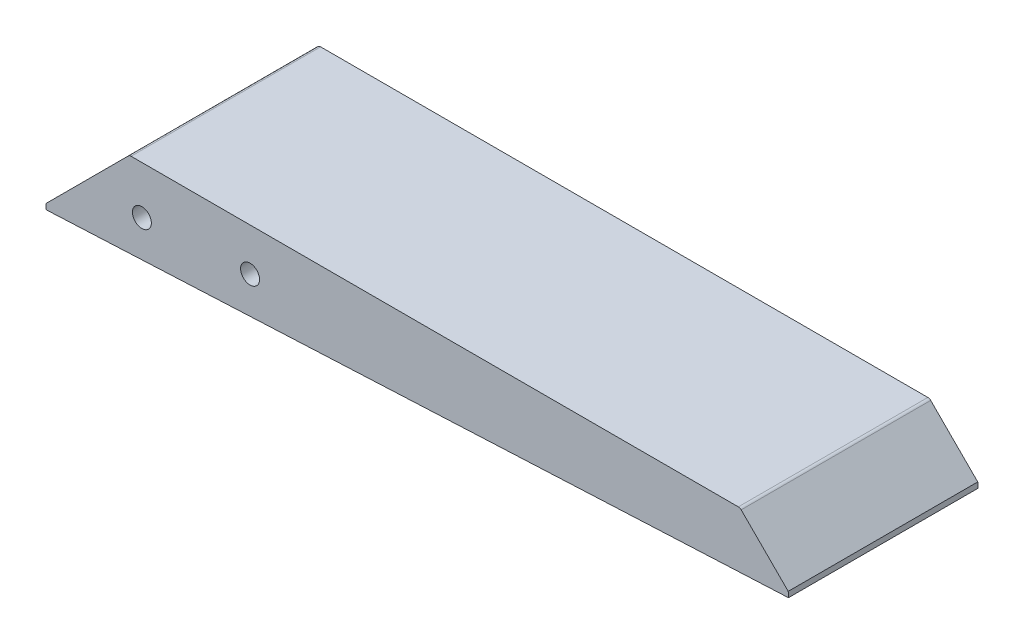
from build123d import *

# Parameters (mm, degrees)
EXTRUDE_1_DEPTH     = 35
SKETCH_2_W          = 137.22254317
SKETCH_2_H          = 35
SKETCH_2_W_2        = 134.22254317
SKETCH_2_H_2        = 32
EXTRUDE_2_DEPTH     = 1
FILLET_1_R          = 2
SKETCH_3_R          = 1.75
CUT_EXTRUDE_1_DEPTH = 6.2
CUT_EXTRUDE_START   = -6.55
SKETCH_4_R          = 1.75
CUT_EXTRUDE_2_DEPTH = 6.55
EXTRUDE_3_DEPTH     = 1


with BuildPart() as part:
    # 草图1 → 凸台-拉伸1 (new body)
    with BuildSketch(Plane.XY):
        with BuildLine():
            Line((29.763864432, 1.094424801), (166.832374142, 7.594424801))
            Line((166.832374142, 7.594424801), (158.142544089, 16.284254855))
            ThreePointArc((158.142544089, 16.284254855), (157.90357385, 16.443929664), (157.621689234, 16.5))
            Line((157.621689234, 16.5), (45.474549341, 16.5))
            ThreePointArc((45.474549341, 16.5), (45.192664725, 16.443929664), (44.953694486, 16.284254855))
            Line((44.953694486, 16.284254855), (29.763864432, 1.094424801))
        make_face()
    extrude(amount=-EXTRUDE_1_DEPTH)

    # 草图2 → 凸台-拉伸2 (add)
    with BuildSketch(Plane(origin=(0.015000012, -0.316312203, 0), x_dir=(0.9988774915788264, 0.04736831026320678, 0), z_dir=(0.04736831026320678, -0.9988774915788264, 0))):
        with Locations((98.393566883, -17.5)):
            Rectangle(SKETCH_2_W, SKETCH_2_H)
        with Locations((98.393566883, -17.5)):
            Rectangle(SKETCH_2_W_2, SKETCH_2_H_2, mode=Mode.SUBTRACT)
    extrude(amount=EXTRUDE_2_DEPTH)

    # 圆角1
    fillet_1_edges = [part.edges().sort_by_distance(p)[0] for p in [
        (31.285864825, 0.666038521, -33.5),
        (165.35774206, 7.02393359, -33.5),
        (165.35774206, 7.02393359, -1.5),
        (31.285864825, 0.666038521, -1.5),
    ]]
    fillet(fillet_1_edges, radius=FILLET_1_R)

    # 草图3 → 切除-拉伸1 (cut)
    with BuildSketch(Plane.XY):
        with Locations((47.471291497, 7.690599963)):
            Circle(SKETCH_3_R)
        with Locations((67.448676919, 8.641426808)):
            Circle(SKETCH_3_R)
    extrude(amount=-CUT_EXTRUDE_1_DEPTH, mode=Mode.SUBTRACT)

    # 草图4 → 切除-拉伸2 (cut)
    with BuildSketch(Plane(origin=(0, 0, -35), x_dir=(-1, 0, 0), z_dir=(0, 0, -1)).offset(CUT_EXTRUDE_START)):
        with Locations((-47.471291497, 7.690599963)):
            Circle(SKETCH_4_R)
        with Locations((-67.448676919, 8.641426808)):
            Circle(SKETCH_4_R)
    extrude(amount=CUT_EXTRUDE_2_DEPTH, mode=Mode.SUBTRACT)

    # 草图6 → 凸台-拉伸3 (add)
    # profile 1 of 11: a face of its own
    with BuildSketch(Plane(origin=(0.015000012, -0.316312203, 0), x_dir=(0.9988774915788264, 0.04736831026320678, 0), z_dir=(0.04736831026320678, -0.9988774915788264, 0))):
        Polygon((144.533247979, -18.341711689), (144.298447979, -18.200811689), (143.922747979, -18.294711689), (142.795647979, -19.468811689), (142.279047979, -19.891511689), (142.138147979, -19.891511689), (142.091147979, -19.750611689), (142.654747979, -18.247811689), (142.701647979, -17.825111689), (142.466847979, -17.496311689), (141.997247979, -17.449411689), (141.668447979, -17.731211689), (141.245747979, -18.388711689), (140.259547979, -19.374911689), (139.226347979, -20.126311689), (138.803647979, -20.314211689), (138.615747979, -20.314211689), (138.521847979, -20.220311689), (138.521847979, -19.985411689), (138.662747979, -19.609711689), (139.461147979, -18.435611689), (139.461147979, -18.106911689), (139.273247979, -17.872011689), (139.038447979, -17.778111689), (138.662747979, -17.872011689), (138.005247979, -18.623511689), (137.582547979, -19.327911689), (137.347747979, -20.126311689), (137.347747979, -20.408111689), (137.488647979, -20.783811689), (137.911347979, -21.159511689), (138.193147979, -21.253511689), (138.756647979, -21.253511689), (139.695947979, -20.877811689), (140.635247979, -20.173311689), (140.776147979, -20.220311689), (140.635247979, -20.830811689), (140.541347979, -20.924711689), (138.521847979, -21.817011689), (137.958247979, -22.192811689), (137.629547979, -22.521511689), (137.441647979, -22.850311689), (137.441647979, -23.272911689), (137.676547979, -23.648711689), (138.005247979, -23.883511689), (138.380947979, -24.024411689), (139.179347979, -24.071311689), (139.836847979, -23.883511689), (140.447347979, -23.507811689), (141.010947979, -22.850311689), (141.480647979, -21.817011689), (141.621547979, -21.300411689), (142.842547979, -20.596011689), (143.734847979, -19.844511689), (144.486347979, -18.952211689), (144.580247979, -18.764411689), align=None)
        Polygon((140.212547979, -21.957911689), (140.212547979, -22.098811689), (140.024747979, -22.474511689), (139.555047979, -22.991211689), (139.085447979, -23.226011689), (138.662747979, -23.226011689), (138.521847979, -23.085111689), (138.568847979, -22.850311689), (138.803647979, -22.568511689), (140.071647979, -21.911011689), align=None, mode=Mode.SUBTRACT)
    # profile 2 of 11: a face of its own
    with BuildSketch(Plane(origin=(0.015000012, -0.316312203, 0), x_dir=(0.9988774915788264, 0.04736831026320678, 0), z_dir=(0.04736831026320678, -0.9988774915788264, 0))):
        Polygon((156.978847979, -14.866311689), (156.744047979, -14.725411689), (156.415247979, -14.725411689), (156.133447979, -14.913311689), (156.039547979, -15.148111689), (155.992547979, -16.087411689), (155.569847979, -17.167611689), (154.771547979, -18.341711689), (153.973147979, -19.046211689), (153.691347979, -18.999211689), (153.691347979, -18.341711689), (153.879147979, -17.731211689), (153.879147979, -17.308511689), (153.691347979, -17.073611689), (153.503447979, -16.979711689), (153.268647979, -16.979711689), (153.033847979, -17.073611689), (152.845947979, -17.261511689), (152.376347979, -18.106911689), (151.390047979, -19.140111689), (151.108247979, -19.327911689), (150.920447979, -19.281011689), (150.967347979, -18.905311689), (151.202247979, -18.247811689), (152.000647979, -16.791911689), (151.953647979, -16.369211689), (151.577947979, -16.134411689), (151.202247979, -16.228311689), (150.920447979, -16.510111689), (150.122047979, -17.872011689), (149.887247979, -18.623511689), (149.041847979, -19.421911689), (148.478247979, -19.844511689), (148.243447979, -19.938511689), (147.961647979, -19.938511689), (147.726847979, -19.797611689), (147.351147979, -19.421911689), (147.351147979, -19.281011689), (149.182747979, -17.543311689), (149.276647979, -17.355411689), (149.276647979, -17.120611689), (149.041847979, -16.838811689), (148.666147979, -16.791911689), (148.337347979, -16.932811689), (146.646647979, -18.482611689), (146.505747979, -18.482611689), (145.660447979, -17.543311689), (145.190747979, -17.496311689), (145.002947979, -17.590311689), (144.815047979, -17.825111689), (144.815047979, -18.106911689), (145.754347979, -19.281011689), (145.754347979, -19.374911689), (144.110647979, -21.206511689), (143.922747979, -21.582211689), (143.969747979, -21.864011689), (144.251547979, -22.098811689), (144.580247979, -22.098811689), (144.815047979, -22.004911689), (146.458847979, -20.220311689), (146.599747979, -20.220311689), (147.069347979, -20.642911689), (147.492047979, -20.877811689), (148.290447979, -20.924711689), (149.088847979, -20.549011689), (149.746347979, -19.938511689), (149.887247979, -19.938511689), (150.169047979, -20.267211689), (150.403847979, -20.408111689), (150.920447979, -20.455111689), (151.249147979, -20.361111689), (151.812747979, -20.032411689), (152.517247979, -19.374911689), (152.658147979, -19.421911689), (152.752047979, -19.656711689), (153.033847979, -19.938511689), (153.456547979, -20.126311689), (154.067047979, -20.079411689), (154.536647979, -19.891511689), (155.288147979, -19.327911689), (155.757747979, -18.858311689), (156.274347979, -18.153811689), (156.744047979, -17.308511689), (157.119747979, -16.040411689), (157.119747979, -15.195111689), align=None)
    # profile 3 of 11: a face of its own
    with BuildSketch(Plane(origin=(0.015000012, -0.316312203, 0), x_dir=(0.9988774915788264, 0.04736831026320678, 0), z_dir=(0.04736831026320678, -0.9988774915788264, 0))):
        Polygon((103.178, -10.815686264), (102.5205, -10.486886264), (101.7221, -10.252086264), (100.2192, -10.252086264), (99.5148, -10.533886264), (99.0921, -10.862586264), (97.4014, -11.614086264), (95.8985, -12.130686264), (94.8653, -12.271586264), (94.6305, -12.459386264), (94.5365, -12.647286264), (94.5835, -12.929086264), (95.0531, -13.398686264), (95.4289, -13.586586264), (96.0864, -13.774386264), (97.6362, -13.774386264), (97.824, -14.103186264), (97.871, -14.995486264), (97.7771, -15.324186264), (96.556, -15.793886264), (95.8046, -16.263486264), (94.9592, -15.981686264), (94.4896, -15.981686264), (94.1608, -16.122586264), (94.0199, -16.263486264), (93.926, -16.545286264), (94.2078, -17.484586264), (94.2548, -18.893486264), (94.3956, -19.738886264), (94.6305, -20.396386264), (94.9123, -20.865986264), (95.4758, -21.429586264), (95.9924, -21.664386264), (96.603, -21.711386264), (97.3544, -21.476586264), (97.5423, -21.476586264), (97.5892, -21.664386264), (97.4483, -22.321886264), (97.2605, -22.791586264), (96.7908, -23.355086264), (95.1471, -23.824786264), (93.6442, -24.106586264), (92.7519, -24.153486264), (92.4701, -24.294386264), (92.1883, -24.623186264), (92.0944, -25.092786264), (92.3292, -25.656386264), (92.7519, -26.079086264), (93.4094, -26.454786264), (93.973, -26.642586264), (95.5228, -26.642586264), (96.4621, -26.407786264), (100.5949, -24.904986264), (102.9431, -24.200486264), (103.3658, -24.247486264), (103.9764, -25.280686264), (104.446, -25.703386264), (104.9156, -25.938186264), (105.3853, -26.032086264), (105.9019, -25.985086264), (106.4185, -25.750286264), (106.7942, -25.374586264), (107.029, -24.764086264), (107.029, -24.200486264), (106.8881, -23.683886264), (106.5594, -23.120286264), (105.8549, -22.368886264), (104.9156, -21.711386264), (103.8824, -21.241686264), (103.178, -21.053886264), (102.6144, -21.100886264), (102.4265, -21.194786264), (102.2387, -21.476586264), (102.3326, -21.852286264), (102.6144, -22.180986264), (102.5205, -22.368886264), (101.2524, -22.556686264), (100.2662, -22.791586264), (99.9374, -22.744586264), (99.9374, -22.603686264), (100.2662, -21.946186264), (100.5949, -20.772086264), (100.7358, -20.678186264), (101.5342, -20.490286264), (102.8492, -20.349386264), (103.5067, -20.114586264), (103.8355, -19.785886264), (103.9764, -19.457086264), (104.5399, -18.658686264), (105.3383, -17.014986264), (105.3383, -16.357486264), (105.2444, -16.075686264), (105.0096, -15.699986264), (104.1642, -14.995486264), (103.6006, -14.713686264), (102.5674, -14.431886264), (101.5812, -14.431886264), (101.2524, -14.525886264), (100.8298, -14.478886264), (100.7828, -13.962286264), (100.6889, -13.774386264), (100.6889, -13.633486264), (100.7828, -13.539586264), (103.2249, -12.929086264), (103.7885, -12.459386264), (103.9294, -12.130686264), (103.8824, -11.614086264), (103.7415, -11.332286264), align=None)
        Polygon((97.7301, -17.296686264), (97.7301, -19.316186264), (97.4014, -19.550986264), (96.8848, -19.597986264), (96.6969, -19.457086264), (96.556, -19.034386264), (96.509, -17.907286264), (96.6499, -17.766386264), (97.5892, -17.296686264), align=None, mode=Mode.SUBTRACT)
        Polygon((101.816, -16.357486264), (102.0508, -16.545286264), (102.0978, -16.686186264), (102.0508, -17.061886264), (101.863, -17.578486264), (101.3933, -18.376886264), (101.0646, -18.611786264), (100.7828, -18.658686264), (100.7358, -18.189086264), (100.8298, -16.592286264), (100.9237, -16.498386264), (101.2524, -16.404386264), align=None, mode=Mode.SUBTRACT)
    # profile 4 of 11: a face of its own
    with BuildSketch(Plane(origin=(0.015000012, -0.316312203, 0), x_dir=(0.9988774915788264, 0.04736831026320678, 0), z_dir=(0.04736831026320678, -0.9988774915788264, 0))):
        Polygon((128.0221, -9.970286264), (127.5524, -9.923386264), (126.9419, -10.299086264), (124.7815, -12.459386264), (124.6406, -12.459386264), (123.2787, -10.862586264), (122.9969, -10.721786264), (122.7151, -10.721786264), (122.3394, -10.956586264), (122.2455, -11.332286264), (122.3864, -11.660986264), (123.7483, -13.398686264), (123.7483, -13.539586264), (122.1515, -15.418186264), (121.541, -16.310486264), (121.3062, -16.780086264), (121.3062, -17.155886264), (121.4471, -17.390686264), (121.7289, -17.531586264), (122.0106, -17.531586264), (122.2455, -17.437586264), (122.4803, -17.202786264), (123.1378, -16.216586264), (124.5937, -14.478886264), (124.7346, -14.478886264), (125.439, -15.089386264), (125.9556, -15.418186264), (126.4253, -15.465086264), (126.754, -15.277286264), (126.848, -15.089386264), (126.801, -14.713686264), (125.5799, -13.539586264), (125.5799, -13.445686264), (128.069, -10.862586264), (128.2569, -10.533886264), (128.2569, -10.299086264), align=None)
    # profile 5 of 11: a face of its own
    with BuildSketch(Plane(origin=(0.015000012, -0.316312203, 0), x_dir=(0.9988774915788264, 0.04736831026320678, 0), z_dir=(0.04736831026320678, -0.9988774915788264, 0))):
        Polygon((132.2489, -9.547586264), (131.8262, -9.406686264), (131.4505, -9.406686264), (130.9339, -9.547586264), (130.4642, -9.829386264), (130.3233, -9.829386264), (130.2764, -9.406686264), (129.9476, -9.077986264), (129.5719, -9.077986264), (129.384, -9.171886264), (129.1962, -9.406686264), (128.2099, -12.177586264), (127.3646, -15.277286264), (126.848, -18.001186264), (126.848, -18.611786264), (127.0828, -18.940486264), (127.5055, -19.034386264), (127.7403, -18.940486264), (127.9751, -18.658686264), (128.2099, -17.108886264), (128.7735, -14.760686264), (129.6189, -14.713686264), (130.5112, -14.244086264), (130.8869, -13.962286264), (131.6853, -13.163886264), (132.3898, -12.130686264), (132.7185, -11.285286264), (132.8124, -10.533886264), (132.6246, -9.923386264), align=None)
        Polygon((131.5444, -10.439986264), (131.6383, -10.674786264), (131.5914, -11.003486264), (131.4505, -11.426186264), (130.9808, -12.224586264), (130.0885, -13.210886264), (129.6658, -13.539586264), (129.1962, -13.727486264), (129.1492, -13.492586264), (129.431, -12.741186264), (130.0415, -11.660986264), (130.8399, -10.768686264), (131.3565, -10.439986264), align=None, mode=Mode.SUBTRACT)
    # profile 6 of 11: a face of its own
    with BuildSketch(Plane(origin=(0.015000012, -0.316312203, 0), x_dir=(0.9988774915788264, 0.04736831026320678, 0), z_dir=(0.04736831026320678, -0.9988774915788264, 0))):
        Polygon((46.3512, -7.669086264), (46.2103, -8.044786264), (46.2103, -8.326586264), (46.4921, -8.890086264), (47.0556, -9.453686264), (48.6524, -10.674786264), (48.5115, -11.238386264), (47.8071, -12.741186264), (47.8071, -13.022986264), (47.9949, -13.210886264), (48.4176, -13.210886264), (49.3569, -12.553386264), (50.3431, -12.036786264), (50.8128, -11.895886264), (51.3764, -11.895886264), (51.9399, -11.754986264), (52.5974, -11.379186264), (52.9262, -11.050486264), (53.161, -10.674786264), (53.3019, -10.017286264), (53.161, -9.453686264), (52.9731, -9.124986264), (52.4565, -8.561386264), (52.0808, -8.279586264), (50.9537, -7.669086264), (49.8735, -7.293386264), (48.6524, -7.058486264), (47.1965, -7.105486264), (46.7269, -7.293386264), align=None)
    # profile 7 of 11: a face of its own
    with BuildSketch(Plane(origin=(0.015000012, -0.316312203, 0), x_dir=(0.9988774915788264, 0.04736831026320678, 0), z_dir=(0.04736831026320678, -0.9988774915788264, 0))):
        Polygon((154.2281, -7.434186264), (154.0403, -7.199386264), (153.6646, -7.199386264), (152.0678, -8.279586264), (151.5042, -8.514386264), (151.1755, -8.561386264), (151.0815, -8.467486264), (151.0815, -8.326586264), (151.5042, -7.011586264), (151.4573, -6.494986264), (151.2224, -6.213186264), (150.9876, -6.119286264), (150.518, -6.166186264), (150.0014, -6.447986264), (149.2969, -7.058486264), (149.156, -7.011586264), (149.109, -6.635886264), (148.9212, -6.447986264), (148.4515, -6.400986264), (148.2167, -6.541886264), (148.0289, -6.823686264), (147.5123, -8.044786264), (146.7139, -8.890086264), (145.9624, -9.547586264), (145.8685, -9.547586264), (145.8215, -9.312786264), (146.573, -7.387286264), (146.573, -7.152486264), (146.3851, -6.870686264), (146.1973, -6.776686264), (145.9155, -6.776686264), (145.7276, -6.870686264), (145.4928, -7.152486264), (144.7883, -8.749186264), (144.6005, -9.500686264), (144.6005, -10.205086264), (144.9292, -10.674786264), (145.258, -10.815686264), (145.5398, -10.815686264), (146.0564, -10.627786264), (147.0896, -9.782486264), (147.2305, -9.782486264), (147.3244, -9.970286264), (147.5123, -10.111186264), (147.9819, -10.111186264), (148.3576, -9.782486264), (148.7333, -9.218886264), (149.8135, -7.950886264), (149.9544, -7.997786264), (149.9074, -8.796186264), (150.0014, -9.077986264), (150.2362, -9.359786264), (150.7998, -9.594586264), (151.6451, -9.500686264), (152.6314, -9.077986264), (153.5237, -8.514386264), (153.9464, -8.138686264), (154.2281, -7.762986264), align=None)
    # profile 8 of 11: a face of its own
    with BuildSketch(Plane(origin=(0.015000012, -0.316312203, 0), x_dir=(0.9988774915788264, 0.04736831026320678, 0), z_dir=(0.04736831026320678, -0.9988774915788264, 0))):
        Polygon((132.8594, -12.882086264), (133.0003, -13.210886264), (133.2351, -13.445686264), (133.5639, -13.586586264), (133.8926, -13.586586264), (134.644, -13.210886264), (135.5364, -12.318486264), (135.6303, -12.318486264), (135.7712, -12.506386264), (136.006, -12.647286264), (136.5226, -12.647286264), (136.7574, -12.553386264), (137.0862, -12.318486264), (137.9315, -11.426186264), (138.0255, -11.426186264), (138.1664, -11.707986264), (138.4012, -11.895886264), (139.0117, -11.942786264), (139.6223, -11.567086264), (140.0449, -11.144386264), (140.7964, -10.205086264), (141.3599, -9.359786264), (142.0174, -9.688486264), (143.0976, -9.829386264), (143.1915, -10.017286264), (142.7689, -10.392986264), (142.0174, -10.674786264), (141.7356, -10.674786264), (141.4069, -10.392986264), (141.1721, -10.392986264), (140.9842, -10.486886264), (140.7964, -10.674786264), (140.7024, -10.909586264), (140.7024, -11.144386264), (140.7964, -11.332286264), (140.9842, -11.520086264), (141.5478, -11.707986264), (142.2992, -11.660986264), (143.1915, -11.332286264), (143.7081, -11.003486264), (144.1778, -10.533886264), (144.4126, -10.064186264), (144.4126, -9.735486264), (144.2248, -9.312786264), (143.943, -9.077986264), (143.2855, -8.843186264), (142.534, -8.749186264), (142.4871, -8.467486264), (143.0506, -7.950886264), (143.1915, -7.997786264), (143.2385, -8.232586264), (143.4264, -8.373486264), (143.849, -8.326586264), (144.1308, -8.091786264), (144.4126, -7.669086264), (144.4596, -7.293386264), (144.3656, -7.058486264), (144.2248, -6.917586264), (143.896, -6.776686264), (143.4264, -6.776686264), (142.8158, -6.964586264), (142.1583, -7.340286264), (141.4069, -8.091786264), (140.8903, -8.467486264), (139.2465, -10.533886264), (139.1056, -10.486886264), (139.1056, -10.345986264), (139.4344, -9.218886264), (139.4344, -8.702286264), (139.1526, -8.420486264), (138.683, -8.467486264), (138.4481, -8.702286264), (138.0724, -9.594586264), (137.7437, -10.111186264), (136.8044, -11.238386264), (136.6635, -11.191386264), (136.6635, -11.050486264), (137.0392, -10.064186264), (137.274, -9.641586264), (137.321, -9.124986264), (137.0862, -8.843186264), (136.9453, -8.796186264), (136.5226, -8.890086264), (136.1469, -9.406686264), (135.7712, -10.158186264), (135.5364, -10.862586264), (135.0198, -11.473186264), (134.1274, -12.365486264), (134.0335, -12.365486264), (133.9865, -12.083686264), (134.0805, -11.520086264), (134.4092, -10.299086264), (135.4424, -7.809986264), (136.006, -6.025286264), (136.006, -5.696586264), (135.7712, -5.367786264), (135.2076, -5.367786264), (134.9258, -5.649586264), (134.5031, -6.400986264), (134.1274, -7.246386264), (133.4699, -9.124986264), (133.0473, -10.721786264), (132.8594, -11.754986264), align=None)
    # profile 9 of 11: a face of its own
    with BuildSketch(Plane(origin=(0.015000012, -0.316312203, 0), x_dir=(0.9988774915788264, 0.04736831026320678, 0), z_dir=(0.04736831026320678, -0.9988774915788264, 0))):
        Polygon((146.9956, -4.898186264), (146.573, -4.898186264), (146.1033, -5.320886264), (145.8215, -5.931386264), (145.8685, -6.260086264), (146.0564, -6.494986264), (146.4321, -6.588886264), (146.7608, -6.447986264), (147.1365, -5.931386264), (147.3244, -5.367786264), (147.2305, -5.085986264), align=None)
    # profile 10 of 11: a face of its own
    with BuildSketch(Plane(origin=(0.015000012, -0.316312203, 0), x_dir=(0.9988774915788264, 0.04736831026320678, 0), z_dir=(0.04736831026320678, -0.9988774915788264, 0))):
        Polygon((83.1712, -24.294386264), (82.9833, -24.012586264), (82.7955, -23.918686264), (82.4198, -23.918686264), (76.0796, -25.186786264), (73.6844, -25.562486264), (71.1483, -25.844186264), (69.6455, -25.938186264), (67.1094, -25.938186264), (65.1839, -25.797286264), (64.7142, -25.703386264), (64.7612, -25.562486264), (65.2778, -25.562486264), (66.264, -25.186786264), (67.2033, -24.341386264), (67.579, -23.824786264), (68.0956, -22.791586264), (68.3774, -22.040086264), (68.7062, -20.772086264), (68.941, -19.316186264), (69.1758, -19.316186264), (70.209, -19.738886264), (71.7119, -20.490286264), (74.5767, -22.134086264), (75.9856, -22.603686264), (76.9719, -22.603686264), (77.6764, -22.321886264), (78.099, -21.946186264), (78.3808, -21.382586264), (78.3808, -20.772086264), (78.2869, -20.443386264), (77.8173, -19.738886264), (77.3476, -19.316186264), (75.9856, -18.517786264), (74.3419, -17.907286264), (72.6512, -17.484586264), (70.5848, -17.155886264), (69.1289, -17.061886264), (68.894, -16.967986264), (68.941, -16.827086264), (70.8196, -16.122586264), (72.1815, -15.418186264), (73.3556, -14.619786264), (74.201, -13.774386264), (74.4828, -13.257786264), (74.5298, -12.506386264), (74.248, -11.895886264), (73.6844, -11.379186264), (73.2148, -11.144386264), (72.5573, -10.956586264), (71.524, -10.956586264), (70.6787, -11.238386264), (70.3969, -11.614086264), (70.4908, -11.942786264), (70.6787, -12.130686264), (70.6787, -12.365486264), (70.5378, -12.647286264), (69.5985, -13.821386264), (69.0349, -14.384986264), (68.0956, -15.136386264), (67.9078, -15.042486264), (67.579, -14.525886264), (66.6398, -13.633486264), (66.0762, -13.257786264), (65.1369, -12.835086264), (65.1369, -12.741186264), (66.5928, -11.379186264), (67.2503, -10.580886264), (67.4381, -10.158186264), (67.4381, -9.641586264), (67.1564, -9.124986264), (67.2033, -8.984086264), (70.5848, -7.762986264), (71.1483, -7.481186264), (71.571, -7.058486264), (71.7589, -6.729786264), (71.7589, -5.837486264), (71.524, -5.414786264), (70.9135, -4.898186264), (70.256, -4.616386264), (69.7864, -4.522486264), (68.894, -4.522486264), (68.1896, -4.663386264), (67.3912, -4.945086264), (62.7417, -7.152486264), (60.2526, -8.185686264), (57.9983, -8.890086264), (56.8712, -9.077986264), (56.3076, -9.077986264), (56.0258, -9.218886264), (55.8849, -9.453686264), (55.9789, -9.829386264), (56.4485, -10.205086264), (56.9181, -10.439986264), (57.8105, -10.674786264), (58.7498, -10.768686264), (59.9239, -10.721786264), (61.1919, -10.533886264), (61.8494, -10.345986264), (62.0373, -10.345986264), (62.0842, -10.533886264), (61.2858, -11.520086264), (60.0648, -12.741186264), (59.1255, -13.539586264), (57.9983, -14.384986264), (56.8712, -15.089386264), (56.0258, -15.512086264), (55.5092, -15.652986264), (55.3214, -15.793886264), (55.2274, -16.075686264), (55.4153, -16.310486264), (55.744, -16.451386264), (56.3546, -16.498386264), (57.9514, -16.263486264), (58.8437, -16.028686264), (59.8299, -15.652986264), (60.0648, -15.699986264), (59.9708, -15.981686264), (59.6421, -16.357486264), (58.1392, -17.672486264), (56.4485, -18.846586264), (55.838, -19.175286264), (55.3214, -19.316186264), (55.0865, -19.644986264), (55.1805, -19.926786264), (55.6501, -20.255486264), (56.1667, -20.396386264), (57.106, -20.396386264), (57.5756, -20.302486264), (58.5149, -19.973686264), (59.3603, -19.550986264), (60.5344, -18.752586264), (61.6146, -17.813386264), (61.7555, -17.813386264), (61.8494, -17.907286264), (61.8964, -18.142086264), (61.4267, -18.846586264), (60.6283, -19.691886264), (58.7967, -21.194786264), (57.7165, -21.899186264), (56.2606, -22.650686264), (55.3214, -23.026386264), (54.476, -23.261186264), (54.2881, -23.495986264), (54.3351, -23.683886264), (54.6639, -23.918686264), (55.1805, -24.012586264), (56.4015, -23.918686264), (58.2331, -23.542986264), (60.7223, -22.650686264), (61.098, -23.402086264), (62.0842, -24.482286264), (62.9765, -25.092786264), (63.5871, -25.374586264), (64.0098, -25.468486264), (64.0098, -25.656386264), (54.2881, -24.294386264), (51.4703, -24.059586264), (51.4233, -23.918686264), (51.893, -23.589986264), (52.4565, -22.932486264), (52.6444, -22.509786264), (52.6914, -21.993186264), (52.4565, -21.335686264), (51.3294, -19.879786264), (51.2355, -19.550986264), (51.2355, -19.081386264), (51.3294, -18.752586264), (51.7051, -18.095086264), (53.208, -16.451386264), (53.3958, -16.028686264), (53.3958, -15.699986264), (53.3019, -15.371186264), (53.114, -15.089386264), (52.6914, -14.713686264), (52.2217, -14.478886264), (51.4703, -14.290986264), (50.531, -14.290986264), (49.8265, -14.478886264), (49.4978, -14.666786264), (49.0281, -15.183386264), (46.9617, -16.075686264), (45.4119, -16.592286264), (44.1439, -16.827086264), (43.8151, -17.108886264), (43.6742, -17.390686264), (43.6742, -17.860286264), (43.7681, -18.048186264), (44.1439, -18.423886264), (44.6135, -18.658686264), (45.271, -18.846586264), (46.3981, -18.846586264), (46.9148, -18.752586264), (48.7464, -18.142086264), (48.7933, -18.329986264), (48.5115, -19.175286264), (48.5115, -19.738886264), (48.7464, -20.349386264), (49.4508, -21.288686264), (49.5917, -21.664386264), (49.4508, -22.180986264), (49.0751, -22.603686264), (48.6055, -22.932486264), (47.3844, -23.449086264), (42.0305, -24.341386264), (39.2126, -25.092786264), (38.743, -25.327586264), (38.4142, -25.656386264), (38.2733, -26.032086264), (38.2733, -26.313886264), (38.4612, -26.783486264), (38.743, -27.112286264), (39.2596, -27.487986264), (40.1989, -27.816786264), (41.0442, -27.863686264), (42.1244, -27.581886264), (44.4726, -26.454786264), (46.2103, -25.985086264), (48.1828, -25.750286264), (50.2962, -25.750286264), (52.0808, -25.891186264), (54.5699, -26.266886264), (57.1999, -26.830486264), (64.4794, -28.709086264), (67.5321, -29.366586264), (70.209, -29.742286264), (72.6981, -29.789186264), (74.201, -29.601386264), (75.1873, -29.366586264), (77.0189, -28.709086264), (78.193, -28.145486264), (80.1655, -26.971386264), (81.5744, -25.985086264), (82.3728, -25.327586264), (83.0303, -24.670086264), (83.1712, -24.435286264), align=None)
        Polygon((64.5733, -19.316186264), (64.6203, -19.691886264), (64.4324, -20.959986264), (64.1037, -22.040086264), (63.8219, -22.556686264), (63.3992, -22.885486264), (62.7417, -22.932486264), (62.0373, -22.697586264), (61.5206, -22.415886264), (61.5206, -22.227986264), (62.0373, -21.946186264), (62.8826, -21.335686264), (63.681, -20.584286264), (64.1037, -20.067586264), (64.4324, -19.363186264), align=None, mode=Mode.SUBTRACT)
        Polygon((61.1449, -15.183386264), (62.366, -14.572786264), (62.9296, -14.197086264), (63.1174, -14.197086264), (63.5401, -14.666786264), (64.0098, -15.465086264), (64.2915, -16.216586264), (64.3855, -16.827086264), (64.1976, -16.920986264), (62.366, -17.155886264), (62.319, -16.967986264), (62.5069, -16.592286264), (62.5069, -16.216586264), (62.413, -15.981686264), (62.0373, -15.605986264), (61.8024, -15.465086264), (61.1919, -15.324186264), align=None, mode=Mode.SUBTRACT)
    # profile 11 of 11: a face of its own
    with BuildSketch(Plane(origin=(0.015000012, -0.316312203, 0), x_dir=(0.9988774915788264, 0.04736831026320678, 0), z_dir=(0.04736831026320678, -0.9988774915788264, 0))):
        Polygon((123.2787, -26.032086264), (123.0908, -25.186786264), (122.856, -24.576186264), (122.4803, -23.824786264), (121.6349, -22.462786264), (119.6624, -19.879786264), (118.6292, -18.705686264), (118.0187, -18.235986264), (117.549, -18.282986264), (117.3612, -18.517786264), (117.3612, -18.846586264), (117.9248, -20.396386264), (118.2535, -21.664386264), (118.4414, -22.791586264), (118.4414, -24.106586264), (118.3005, -24.576186264), (118.0656, -24.857986264), (117.7369, -24.998886264), (116.8446, -24.998886264), (115.9053, -24.810986264), (114.919, -24.482286264), (114.1206, -24.106586264), (113.3692, -23.636886264), (112.7117, -23.120286264), (111.7255, -22.087086264), (111.068, -21.100886264), (110.3635, -19.504086264), (109.8939, -17.719386264), (109.706, -16.028686264), (109.753, -14.056186264), (110.0348, -12.083686264), (110.2226, -11.332286264), (110.7392, -9.923386264), (111.6315, -8.185686264), (111.6315, -7.199386264), (111.2089, -6.400986264), (110.4105, -5.602586264), (109.2364, -4.804186264), (108.6728, -4.522486264), (107.7335, -4.193686264), (107.2169, -4.099786264), (105.8549, -4.099786264), (104.399, -4.287586264), (102.4265, -4.663386264), (97.4953, -5.931386264), (95.4289, -6.635886264), (93.879, -7.340286264), (93.2215, -7.762986264), (92.8458, -8.138686264), (92.611, -8.514386264), (92.5171, -8.514386264), (92.1414, -8.185686264), (91.249, -7.809986264), (90.5915, -7.809986264), (90.2158, -7.950886264), (89.8871, -8.232586264), (89.7462, -8.467486264), (89.6523, -8.890086264), (89.6523, -9.312786264), (89.8401, -10.486886264), (89.8401, -13.398686264), (89.7462, -14.760686264), (89.3705, -17.437586264), (88.8069, -19.832786264), (87.8676, -22.556686264), (87.0692, -24.106586264), (86.8814, -24.294386264), (86.6935, -24.200486264), (86.5996, -23.449086264), (86.3178, -23.167286264), (85.989, -23.214286264), (85.5194, -23.777786264), (85.2376, -24.388386264), (85.0028, -25.186786264), (84.9089, -25.844186264), (84.9089, -26.642586264), (85.1437, -27.394086264), (85.7073, -27.957586264), (86.083, -28.098486264), (86.7874, -28.098486264), (87.351, -27.910686264), (88.2433, -27.347086264), (89.1356, -26.501686264), (89.981, -25.421586264), (90.9203, -23.871786264), (91.6248, -22.321886264), (92.3292, -20.349386264), (93.1746, -16.733186264), (93.4094, -15.042486264), (93.5503, -13.257786264), (93.5503, -11.050486264), (93.3624, -9.970286264), (93.4564, -9.782486264), (94.7714, -9.782486264), (100.5949, -7.856886264), (103.5537, -7.105486264), (105.4792, -6.776686264), (106.3246, -6.823686264), (106.5594, -7.058486264), (106.6533, -7.293386264), (106.6533, -8.279586264), (106.2306, -11.520086264), (106.0898, -14.478886264), (106.1837, -17.061886264), (106.5124, -19.128386264), (106.9351, -20.537286264), (107.6865, -22.274986264), (108.6728, -23.871786264), (109.753, -25.186786264), (111.3967, -26.642586264), (112.4299, -27.347086264), (113.8858, -28.145486264), (115.1539, -28.662086264), (116.7976, -29.131786264), (117.8778, -29.319586264), (119.0049, -29.413486264), (119.8033, -29.413486264), (120.9305, -29.272586264), (121.8228, -28.990886264), (122.4803, -28.568186264), (122.856, -28.145486264), (123.1848, -27.440986264), (123.2787, -26.924386264), align=None)
    extrude(amount=EXTRUDE_3_DEPTH)


solid = part.part
